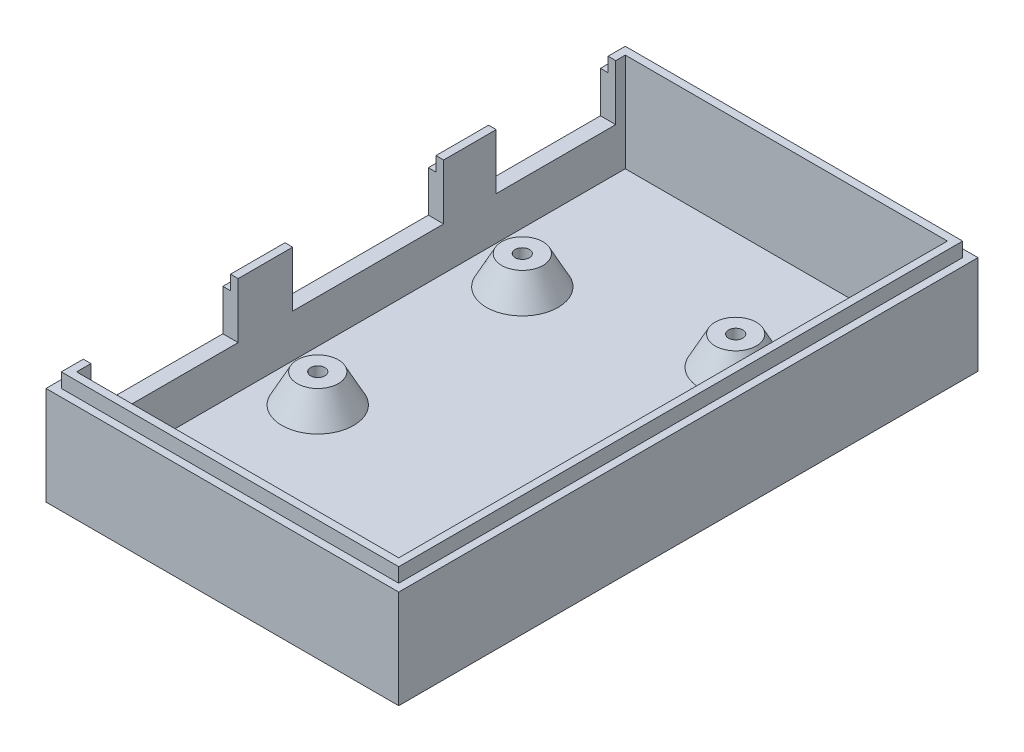
from build123d import *

# Parameters (mm, degrees)
SKETCH_2_W            = 36.9
SKETCH_2_H            = 60.6
SKETCH_2_W_2          = 33.7
SKETCH_2_H_2          = 57.4
SKETCH_2_R            = 3.75
SKETCH_2_R_2          = 2.25
SKETCH_2_R_3          = 0.75
EXTRUDE_1_DEPTH       = 1.5
EXTRUDE_2_OUTLINE_R   = 2.154871705
EXTRUDE_2_DEPTH       = 3
EXTRUDE_2_DRAFT       = 28
EXTRUDE_2_2_OUTLINE_R = 2.154871705
EXTRUDE_2_2_DEPTH     = 3
EXTRUDE_2_2_DRAFT     = 28
EXTRUDE_2_3_DEPTH     = 3
EXTRUDE_2_3_DRAFT     = 28
EXTRUDE_2_4_OUTLINE_R = 2.154871705
EXTRUDE_2_4_DEPTH     = 3
EXTRUDE_2_4_DRAFT     = 28
EXTRUDE_START         = 1.5
SKETCH_2_11_W         = 36.9
SKETCH_2_11_H         = 60.6
SKETCH_2_11_W_2       = 33.7
SKETCH_2_11_H_2       = 57.4
EXTRUDE_3_DEPTH       = 4.5
SKETCH_3_W            = 1.6
SKETCH_3_H            = 5.7
SKETCH_3_H_2          = 5.5
EXTRUDE_4_DEPTH       = 4.3
SKETCH_5_W            = 0.8
SKETCH_5_H            = 5.5
SKETCH_5_H_2          = 5.7
EXTRUDE_5_DEPTH       = 1.5
CUT_EXTRUDE_START     = 1.5
SKETCH_2_12_R         = 0.75
CUT_EXTRUDE_1_DEPTH   = 3


# Read off the part's stored shape, not the designer's step: Бобышка-Вытянуть2
with BuildPart() as part:
    # Эскиз2 → Бобышка-Вытянуть1 (new body)
    # profile 1 of 14: a face of its own
    with BuildSketch(Plane(origin=(0, 0, 0), x_dir=(1, 0, 0), z_dir=(0, 1, 0))):
        with Locations((16.65, 28.5)):
            Rectangle(SKETCH_2_W, SKETCH_2_H)
        with Locations((16.65, 28.5)):
            Rectangle(SKETCH_2_W_2, SKETCH_2_H_2, mode=Mode.SUBTRACT)
    # profile 2 of 14: a face of its own
    with BuildSketch(Plane(origin=(0, 0, 0), x_dir=(1, 0, 0), z_dir=(0, 1, 0))):
        with BuildLine():
            Line((-0.2, 57.2), (-0.2, -0.2))
            Line((-0.2, -0.2), (33.5, -0.2))
            Line((33.5, -0.2), (33.5, 10.050490243))
            ThreePointArc((33.5, 10.050490243), (27, 12.6), (33.5, 15.149509757))
            Line((33.5, 15.149509757), (33.5, 57.2))
            Line((33.5, 57.2), (-0.2, 57.2))
        make_face()
        with Locations((5.1, 19.73)):
            Circle(SKETCH_2_R, mode=Mode.SUBTRACT)
        with Locations((5.1, 41.13)):
            Circle(SKETCH_2_R, mode=Mode.SUBTRACT)
        with Locations((23.55, 45)):
            Circle(SKETCH_2_R, mode=Mode.SUBTRACT)
    # profile 3 of 14: a face of its own
    with BuildSketch(Plane(origin=(0, 0, 0), x_dir=(1, 0, 0), z_dir=(0, 1, 0))):
        with Locations((23.55, 45)):
            Circle(SKETCH_2_R)
        with Locations((23.55, 45)):
            Circle(SKETCH_2_R_2, mode=Mode.SUBTRACT)
    # profile 4 of 14: a face of its own
    with BuildSketch(Plane(origin=(0, 0, 0), x_dir=(1, 0, 0), z_dir=(0, 1, 0))):
        with Locations((23.55, 45)):
            Circle(SKETCH_2_R_2)
        with Locations((23.55, 45)):
            Circle(SKETCH_2_R_3, mode=Mode.SUBTRACT)
    # profile 5 of 14: a face of its own
    with BuildSketch(Plane(origin=(0, 0, 0), x_dir=(1, 0, 0), z_dir=(0, 1, 0))):
        with Locations((23.55, 45)):
            Circle(SKETCH_2_R_3)
    # profile 6 of 14: a face of its own
    with BuildSketch(Plane(origin=(0, 0, 0), x_dir=(1, 0, 0), z_dir=(0, 1, 0))):
        with Locations((5.1, 41.13)):
            Circle(SKETCH_2_R)
        with Locations((5.1, 41.13)):
            Circle(SKETCH_2_R_2, mode=Mode.SUBTRACT)
    # profile 7 of 14: a face of its own
    with BuildSketch(Plane(origin=(0, 0, 0), x_dir=(1, 0, 0), z_dir=(0, 1, 0))):
        with Locations((5.1, 41.13)):
            Circle(SKETCH_2_R_2)
        with Locations((5.1, 41.13)):
            Circle(SKETCH_2_R_3, mode=Mode.SUBTRACT)
    # profile 8 of 14: a face of its own
    with BuildSketch(Plane(origin=(0, 0, 0), x_dir=(1, 0, 0), z_dir=(0, 1, 0))):
        with Locations((5.1, 41.13)):
            Circle(SKETCH_2_R_3)
    # profile 9 of 14: a face of its own
    with BuildSketch(Plane(origin=(0, 0, 0), x_dir=(1, 0, 0), z_dir=(0, 1, 0))):
        with Locations((5.1, 19.73)):
            Circle(SKETCH_2_R)
        with Locations((5.1, 19.73)):
            Circle(SKETCH_2_R_2, mode=Mode.SUBTRACT)
    # profile 10 of 14: a face of its own
    with BuildSketch(Plane(origin=(0, 0, 0), x_dir=(1, 0, 0), z_dir=(0, 1, 0))):
        with Locations((5.1, 19.73)):
            Circle(SKETCH_2_R_2)
        with Locations((5.1, 19.73)):
            Circle(SKETCH_2_R_3, mode=Mode.SUBTRACT)
    # profile 11 of 14: a face of its own
    with BuildSketch(Plane(origin=(0, 0, 0), x_dir=(1, 0, 0), z_dir=(0, 1, 0))):
        with Locations((5.1, 19.73)):
            Circle(SKETCH_2_R_3)
    # profile 12 of 14: a face of its own
    with BuildSketch(Plane(origin=(0, 0, 0), x_dir=(1, 0, 0), z_dir=(0, 1, 0))):
        with BuildLine():
            ThreePointArc((33.5, 15.149509757), (27, 12.6), (33.5, 10.050490243))
            Line((33.5, 10.050490243), (33.5, 15.149509757))
        make_face()
        with Locations((30.75, 12.6)):
            Circle(SKETCH_2_R_2, mode=Mode.SUBTRACT)
    # profile 13 of 14: a face of its own
    with BuildSketch(Plane(origin=(0, 0, 0), x_dir=(1, 0, 0), z_dir=(0, 1, 0))):
        with Locations((30.75, 12.6)):
            Circle(SKETCH_2_R_2)
        with Locations((30.75, 12.6)):
            Circle(SKETCH_2_R_3, mode=Mode.SUBTRACT)
    # profile 14 of 14: a face of its own
    with BuildSketch(Plane(origin=(0, 0, 0), x_dir=(1, 0, 0), z_dir=(0, 1, 0))):
        with Locations((30.75, 12.6)):
            Circle(SKETCH_2_R_3)
    extrude(amount=EXTRUDE_1_DEPTH)


with BuildPart() as extrude_2_tool:
    # Бобышка-Вытянуть2 outline → Бобышка-Вытянуть2 (with draft: the straight prism first)
    with BuildSketch(Plane(origin=(0, 4.5, 0), x_dir=(1, 0, 0), z_dir=(0, 1, 0))):
        with Locations((5.1, 41.13)):
            Circle(EXTRUDE_2_OUTLINE_R)
    extrude(amount=-EXTRUDE_2_DEPTH)
    # Бобышка-Вытянуть2: the draft: its side faces are tilted about the plane it starts from
    extrude_2_sides = [extrude_2_tool.faces().sort_by_distance(p)[0] for p in [
        (2.945128295, 3, -41.13),
    ]]
    draft(extrude_2_sides, Plane(origin=(0, 4.5, 0), x_dir=(1, 0, 0), z_dir=(0, 1, 0)), EXTRUDE_2_DRAFT)


with BuildPart() as part_1:
    add(part.part)

    # Бобышка-Вытянуть2: add extrude_2_tool
    add(extrude_2_tool.part)


with BuildPart() as extrude_2_2_tool:
    # Extrude 2 2 outline → Extrude 2 2 (with draft: the straight prism first)
    with BuildSketch(Plane(origin=(0, 4.5, 0), x_dir=(1, 0, 0), z_dir=(0, 1, 0))):
        with Locations((23.55, 45)):
            Circle(EXTRUDE_2_2_OUTLINE_R)
    extrude(amount=-EXTRUDE_2_2_DEPTH)
    # Extrude 2 2: the draft: its side faces are tilted about the plane it starts from
    extrude_2_2_sides = [extrude_2_2_tool.faces().sort_by_distance(p)[0] for p in [
        (21.395128295, 3, -45),
    ]]
    draft(extrude_2_2_sides, Plane(origin=(0, 4.5, 0), x_dir=(1, 0, 0), z_dir=(0, 1, 0)), EXTRUDE_2_2_DRAFT)


with BuildPart() as part_2:
    add(part_1.part)

    # Extrude 2 2: add extrude_2_2_tool
    add(extrude_2_2_tool.part)


with BuildPart() as extrude_2_3_tool:
    # Extrude 2 3 outline → Extrude 2 3 (with draft: the straight prism first)
    with BuildSketch(Plane(origin=(0, 4.5, 0), x_dir=(1, 0, 0), z_dir=(0, 1, 0))):
        with BuildLine():
            ThreePointArc((31.904871705, 14.419270021), (28.595128295, 12.6), (31.904871705, 10.780729979))
            Line((31.904871705, 10.780729979), (31.904871705, 14.419270021))
        make_face()
    extrude(amount=-EXTRUDE_2_3_DEPTH)
    # Extrude 2 3: the draft: its side faces are tilted about the plane it starts from
    extrude_2_3_sides = [extrude_2_3_tool.faces().sort_by_distance(p)[0] for p in [
        (28.595128295, 3, -12.6),
        (31.904871705, 3, -12.6),
    ]]
    draft(extrude_2_3_sides, Plane(origin=(0, 4.5, 0), x_dir=(1, 0, 0), z_dir=(0, 1, 0)), EXTRUDE_2_3_DRAFT)


with BuildPart() as part_3:
    add(part_2.part)

    # Extrude 2 3: add extrude_2_3_tool
    add(extrude_2_3_tool.part)


with BuildPart() as extrude_2_4_tool:
    # Extrude 2 4 outline → Extrude 2 4 (with draft: the straight prism first)
    with BuildSketch(Plane(origin=(0, 4.5, 0), x_dir=(1, 0, 0), z_dir=(0, 1, 0))):
        with Locations((5.1, 19.73)):
            Circle(EXTRUDE_2_4_OUTLINE_R)
    extrude(amount=-EXTRUDE_2_4_DEPTH)
    # Extrude 2 4: the draft: its side faces are tilted about the plane it starts from
    extrude_2_4_sides = [extrude_2_4_tool.faces().sort_by_distance(p)[0] for p in [
        (2.945128295, 3, -19.73),
    ]]
    draft(extrude_2_4_sides, Plane(origin=(0, 4.5, 0), x_dir=(1, 0, 0), z_dir=(0, 1, 0)), EXTRUDE_2_4_DRAFT)


with BuildPart() as part_4:
    add(part_3.part)

    # Extrude 2 4: add extrude_2_4_tool
    add(extrude_2_4_tool.part)

    # Эскиз2<11> → Бобышка-Вытянуть3 (add)
    with BuildSketch(Plane(origin=(0, 0, 0), x_dir=(1, 0, 0), z_dir=(0, 1, 0)).offset(EXTRUDE_START)):
        with Locations((16.65, 28.5)):
            Rectangle(SKETCH_2_11_W, SKETCH_2_11_H)
        with Locations((16.65, 28.5)):
            Rectangle(SKETCH_2_11_W_2, SKETCH_2_11_H_2, mode=Mode.SUBTRACT)
    extrude(amount=EXTRUDE_3_DEPTH)

    # Эскиз3 → Бобышка-Вытянуть4 (add)
    with BuildSketch(Plane(origin=(0, 6, 0), x_dir=(1, 0, 0), z_dir=(0, 1, 0))):
        Polygon((-0.2, 1.3), (-1.8, 1.3), (-1.8, -1.8), (35.1, -1.8), (35.1, 58.8), (-1.8, 58.8), (-1.8, 56.2), (-0.2, 56.2), (-0.2, 57.2), (33.5, 57.2), (33.5, -0.2), (-0.2, -0.2), align=None)
        with Locations((-1, 19.55)):
            Rectangle(SKETCH_3_W, SKETCH_3_H)
        with Locations((-1, 40.95)):
            Rectangle(SKETCH_3_W, SKETCH_3_H_2)
    extrude(amount=EXTRUDE_4_DEPTH)

    # Эскиз5 → Бобышка-Вытянуть5 (add)
    with BuildSketch(Plane(origin=(0, 10.3, 0), x_dir=(1, 0, 0), z_dir=(0, 1, 0))):
        Polygon((-1, -1), (34.3, -1), (34.3, 58), (-1, 58), (-1, 56.2), (-0.2, 56.2), (-0.2, 57.2), (33.5, 57.2), (33.5, -0.2), (-0.2, -0.2), (-0.2, 1.3), (-1, 1.3), align=None)
        with Locations((-0.6, 40.95)):
            Rectangle(SKETCH_5_W, SKETCH_5_H)
        with Locations((-0.6, 19.55)):
            Rectangle(SKETCH_5_W, SKETCH_5_H_2)
    extrude(amount=EXTRUDE_5_DEPTH)

    # Эскиз2<12> → Вырез-Вытянуть1 (cut)
    with BuildSketch(Plane(origin=(0, 0, 0), x_dir=(1, 0, 0), z_dir=(0, 1, 0)).offset(CUT_EXTRUDE_START)):
        with Locations(Location((23.55, 45, 0), (0, 0, 270))):
            Circle(SKETCH_2_12_R)
        with Locations(Location((5.1, 41.13, 0), (0, 0, 270))):
            Circle(SKETCH_2_12_R)
        with Locations(Location((5.1, 19.73, 0), (0, 0, 270))):
            Circle(SKETCH_2_12_R)
        with Locations(Location((30.75, 12.6, 0), (0, 0, 270))):
            Circle(SKETCH_2_12_R)
    extrude(amount=CUT_EXTRUDE_1_DEPTH, mode=Mode.SUBTRACT)


solid = part_4.part
